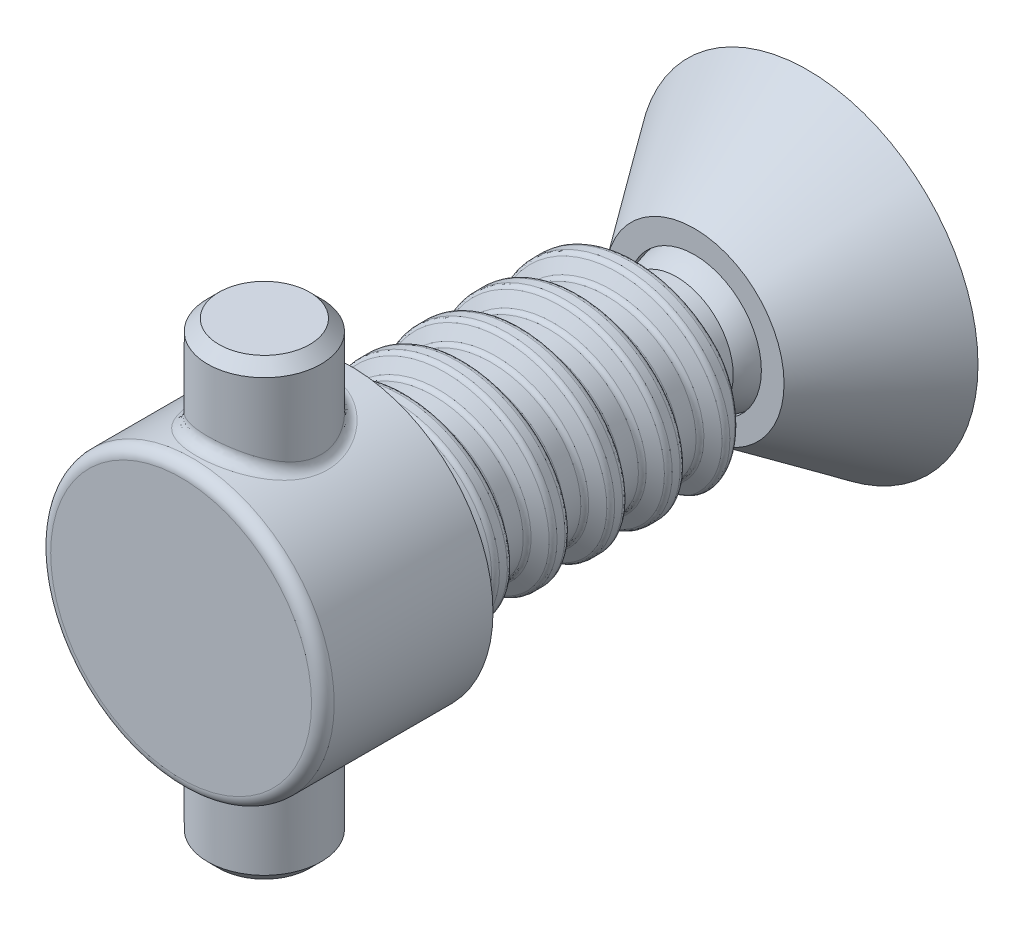
from build123d import *

# Parameters (mm, degrees)
SKETCH1_R                = 12.5
BOSS_EXTRUDE1_DEPTH      = 15
SKETCH2_R                = 7.5
BOSS_EXTRUDE2_DEPTH      = 25
BOSS_EXTRUDE3_DEPTH      = 20
BOSS_EXTRUDE3_DEPTH_BACK = 20
SKETCH3_R                = 5
CHAMFER1_SIZE            = 1
FILLET1_R                = 1
THREAD1_PITCH            = 5.08
THREAD1_TO               = 25
FILLET2_R                = 2
FILLET3_R                = 0.2


with BuildPart() as part:
    # Sketch1 → Boss-Extrude1 (new body)
    with BuildSketch(Plane.XY):
        Circle(SKETCH1_R)
    extrude(amount=BOSS_EXTRUDE1_DEPTH)

    # Sketch2 → Boss-Extrude2 (add)
    with BuildSketch(Plane(origin=(0, 0, 0), x_dir=(-1, 0, 0), z_dir=(0, 0, -1))):
        Circle(SKETCH2_R)
    extrude(amount=BOSS_EXTRUDE2_DEPTH)

    # Sketch3 → Boss-Extrude3 (add, two sides: drawn at the far end of the back side and taken through both)
    with BuildSketch(Plane(origin=(0, 0, 0), x_dir=(1, 0, 0), z_dir=(0, 1, 0)).offset(-BOSS_EXTRUDE3_DEPTH_BACK)):
        with Locations(Location((0, -7.660198043, 0), (0, 0, 270))):
            Circle(SKETCH3_R)
    extrude(amount=BOSS_EXTRUDE3_DEPTH + BOSS_EXTRUDE3_DEPTH_BACK)

    # Chamfer1
    chamfer1_edges = [part.edges().sort_by_distance(p)[0] for p in [
        (0, -20, 2.660198043),
        (0, 20, 2.660198043),
    ]]
    chamfer(chamfer1_edges, length=CHAMFER1_SIZE)

    # Fillet1
    fillet1_edges = [part.edges().sort_by_distance(p)[0] for p in [
        (0, -12.5, 2.660198041),
        (0, 12.5, 2.660198041),
        (-12.5, 0, 15),
    ]]
    fillet(fillet1_edges, radius=FILLET1_R)

    # Thread1: arcs per turn and ends read off the stored shape
    # Thread1: the profile of Thread Profile2 profile screwed along a right-hand helix through 4.92126 turns, 12 arcs to a turn; built about Z, then put on its axis
    thread1_z = Axis((0, 0, 0), (0, 0, 1))
    thread1_corners = [(7.4997, 0, 0), (7.4997, 0, 3.634587873), (7.5, 0, 3.634587873), (7.754, 0, 3.194646968), (8.77, 0, 2.608059095), (9.024, 0, 2.16811819), (9.024, 0, 1.466469684), (8.77, 0, 1.026528779), (7.754, 0, 0.439940905), (7.5, 0, 0)]
    with BuildLine(mode=Mode.PRIVATE) as thread1_profile:
        Line(thread1_corners[0], thread1_corners[1])
        Line(thread1_corners[3], thread1_corners[4])
        Line(thread1_corners[5], thread1_corners[6])
        Line(thread1_corners[7], thread1_corners[8])
        Line(thread1_corners[9], thread1_corners[0])
        Line(thread1_corners[2], thread1_corners[1])
        ThreePointArc((7.5, 0, 3.634587873), (7.568059095, 0, 3.380587873), (7.754, 0, 3.194646968))
        ThreePointArc((8.77, 0, 2.608059095), (8.955940905, 0, 2.42211819), (9.024, 0, 2.16811819))
        ThreePointArc((9.024, 0, 1.466469684), (8.955940905, 0, 1.212469684), (8.77, 0, 1.026528779))
        ThreePointArc((7.754, 0, 0.439940905), (7.568059095, 0, 0.254), (7.5, 0, 0))
    thread1_cap = Face(thread1_profile.wire())
    thread1_arcs = [((7.5, 0, 3.634587873), (7.5, 0, 3.341293937), (7.754, 0, 3.194646968), (1, 0.866025403784437, 1)), ((8.77, 0, 2.608059095), (9.024, 0, 2.461412127), (9.024, 0, 2.16811819), (1, 0.8660254037844378, 1)), ((9.024, 0, 1.466469684), (9.024, 0, 1.173175747), (8.77, 0, 1.026528779), (1, 0.8660254037844376, 1)), ((7.754, 0, 0.439940905), (7.5, 0, 0.293293937), (7.5, 0, 0), (1, 0.8660254037844366, 1))]  # start, shoulder, end, weights
    thread1_turn_angles = [0, 15, 30, 45, 60, 75, 90, 105, 120, 135, 150, 165, 180, 195, 210, 225, 240, 255, 270, 285, 300, 315, 330, 345, 360]
    thread1_turn_weights = [1, 0.9659258262890683, 1, 0.9659258262890683, 1, 0.9659258262890683, 1, 0.9659258262890683, 1, 0.9659258262890683, 1, 0.9659258262890683, 1, 0.9659258262890683, 1, 0.9659258262890683, 1, 0.9659258262890683, 1, 0.9659258262890683, 1, 0.9659258262890683, 1, 0.9659258262890683, 1]
    thread1_turn_rails = [Edge.make_bspline([Vector(p[0], p[1], 0).rotate(thread1_z, thread1_turn_angles[k]) / thread1_turn_weights[k] + Vector(0, 0, p[2] + THREAD1_PITCH * thread1_turn_angles[k] / 360) for k in range(25)], [0, 0, 0, 1, 1, 2, 2, 3, 3, 4, 4, 5, 5, 6, 6, 7, 7, 8, 8, 9, 9, 10, 10, 11, 11, 12, 12, 12], 2, thread1_turn_weights) for p in thread1_corners]
    thread1_turn_sides = [*[Face.make_surface_from_curves(thread1_turn_rails[p[0]], thread1_turn_rails[p[1]]) for p in [(0, 1), (3, 4), (5, 6), (7, 8), (9, 0), (2, 1)]], *[Face.make_bezier_surface([[Vector(p[j][0], p[j][1], 0).rotate(thread1_z, thread1_turn_angles[2 * i + k]) / thread1_turn_weights[2 * i + k] + Vector(0, 0, p[j][2] + THREAD1_PITCH * thread1_turn_angles[2 * i + k] / 360) for k in range(3)] for j in range(3)], [[p[3][j] * thread1_turn_weights[2 * i + k] for k in range(3)] for j in range(3)]) for p in thread1_arcs for i in range(12)]]
    thread1_last_angles = [1440, 1455, 1470, 1485, 1500, 1515, 1530, 1545, 1560, 1575, 1590, 1605, 1620, 1635, 1650, 1665, 1680, 1695, 1710, 1725, 1740, 1755, 1770, 1770.826771654, 1771.653543307]
    thread1_last_weights = [1, 0.9659258262890683, 1, 0.9659258262890683, 1, 0.9659258262890683, 1, 0.9659258262890683, 1, 0.9659258262890683, 1, 0.9659258262890683, 1, 0.9659258262890683, 1, 0.9659258262890683, 1, 0.9659258262890683, 1, 0.9659258262890683, 1, 0.9659258262890683, 1, 0.9998958909796289, 1]
    thread1_last_rails = [Edge.make_bspline([Vector(p[0], p[1], 0).rotate(thread1_z, thread1_last_angles[k]) / thread1_last_weights[k] + Vector(0, 0, p[2] + THREAD1_PITCH * thread1_last_angles[k] / 360) for k in range(25)], [0, 0, 0, 1, 1, 2, 2, 3, 3, 4, 4, 5, 5, 6, 6, 7, 7, 8, 8, 9, 9, 10, 10, 11, 11, 12, 12, 12], 2, thread1_last_weights) for p in thread1_corners]
    thread1_last_sides = [*[Face.make_surface_from_curves(thread1_last_rails[p[0]], thread1_last_rails[p[1]]) for p in [(0, 1), (3, 4), (5, 6), (7, 8), (9, 0), (2, 1)]], *[Face.make_bezier_surface([[Vector(p[j][0], p[j][1], 0).rotate(thread1_z, thread1_last_angles[2 * i + k]) / thread1_last_weights[2 * i + k] + Vector(0, 0, p[j][2] + THREAD1_PITCH * thread1_last_angles[2 * i + k] / 360) for k in range(3)] for j in range(3)], [[p[3][j] * thread1_last_weights[2 * i + k] for k in range(3)] for j in range(3)]) for p in thread1_arcs for i in range(12)]]
    thread1 = Plane(origin=(0, 0, 0), x_dir=(-1, 0, 0), z_dir=(0, 0, -1)) * split(Solid(Shell([*[p.moved(Location((0, 0, THREAD1_PITCH * i))) for i in range(4) for p in thread1_turn_sides], *thread1_last_sides, thread1_cap, thread1_cap.rotate(thread1_z, 1771.653543307).moved(Location((0, 0, THREAD1_PITCH * 1771.653543307 / 360)))])), bisect_by=Plane.XY.offset(THREAD1_TO), keep=Keep.BOTTOM, mode=Mode.PRIVATE)
    add(thread1)

    # Sketch5 → Revolve3 (revolve)
    with BuildSketch(Plane(origin=(0, 0, 0), x_dir=(1, 0, 0), z_dir=(0, 1, 0)), mode=Mode.PRIVATE) as revolve3_sk:
        with BuildLine():
            Line((-5, 28.68337521), (-5, 25))
            Line((-5, 25), (0, 25))
            Line((0, 25), (0, 38))
            ThreePointArc((0, 38), (-5.286764074, 34.837274331), (-5, 28.68337521))
        make_face()
    revolve(revolve3_sk.sketch.rotate(Axis((0, 0, -37.683629744), (0, 0, 1)), 180), axis=Axis((0, 0, -37.683629744), (0, 0, 1)))

    # Fillet2
    fillet2_edges = [part.edges().sort_by_distance(p)[0] for p in [
        (-5, 0, -25),
    ]]
    fillet(fillet2_edges, radius=FILLET2_R)

    # Fillet3
    fillet3_edges = [part.edges().sort_by_distance(p)[0] for p in [
        (-5, 0, -27),
        (1.021525265, 7.555049198, -25),
        (4.938332084, 6.639792929, -25),
        (8.63775129, 2.470598351, -25),
        (8.316749679, -3.502035303, -25),
        (5.31935144, -7.280175519, -25),
        (-1.303096952, -8.175759943, -25),
        (-5.352179212, -5.334929949, -25),
    ]]
    fillet(fillet3_edges, radius=FILLET3_R)


with BuildPart() as body_2:
    # Sketch7 → Revolve4 (revolve)
    with BuildSketch(Plane(origin=(0, 0, 0), x_dir=(1, 0, 0), z_dir=(0, 1, 0))):
        with BuildLine():
            Line((0, 38.15), (0, 40.264344504))
            Line((0, 40.264344504), (-15, 40.264344504))
            Line((-15, 40.264344504), (-7.9, 30.264344504))
            Line((-7.9, 30.264344504), (-5.9, 30.264344504))
            ThreePointArc((-5.9, 30.264344504), (-4.924265493, 35.684305817), (0, 38.15))
        make_face()
    revolve(axis=Axis((0, 0, 0), (0, 0, -1)))


solid = Compound([part.part, body_2.part])
